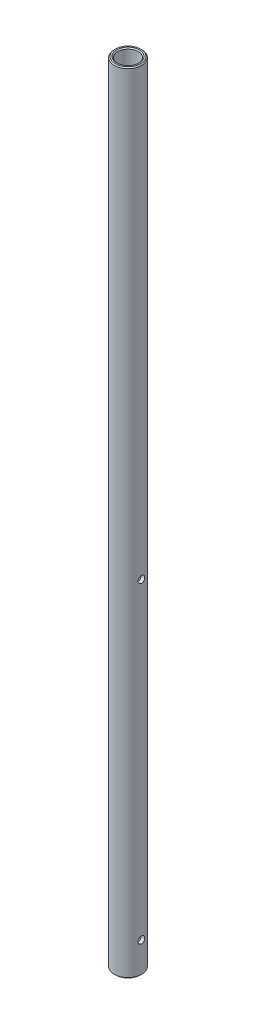
from build123d import *

# Parameters (mm, degrees)
SKETCH_1_R               = 4
SKETCH_1_R_2             = 3
EXTRUDE_1_DEPTH          = 230
CHAMFER_1_SIZE           = 0.3
CUT_EXTRUDE_1_DEPTH      = 231.0695547
CUT_EXTRUDE_1_DEPTH_BACK = 231.0695547
SKETCH_2_R               = 1
CUT_EXTRUDE_2_DEPTH      = 231.069554704
CUT_EXTRUDE_2_DEPTH_BACK = 231.069554704
SKETCH_3_R               = 1


with BuildPart() as part:
    # Эскиз1 → Бобышка-Вытянуть1 (new body)
    with BuildSketch(Plane(origin=(0, 0, 0), x_dir=(1, 0, 0), z_dir=(0, 1, 0))):
        Circle(SKETCH_1_R)
        Circle(SKETCH_1_R_2, mode=Mode.SUBTRACT)
    extrude(amount=EXTRUDE_1_DEPTH)

    # Фаска1
    chamfer_1_edges = [part.edges().sort_by_distance(p)[0] for p in [
        (-3, 230, 0),
        (-3, 0, 0),
        (-4, 0, 0),
        (-4, 230, 0),
    ]]
    chamfer(chamfer_1_edges, length=CHAMFER_1_SIZE)

    # Эскиз2 → Вырез-Вытянуть1 (cut, two sides: drawn at the far end of the back side and taken through both)
    with BuildSketch(Plane(origin=(0, 0, 0), x_dir=(0, 0, -1), z_dir=(1, 0, 0)).offset(-CUT_EXTRUDE_1_DEPTH_BACK)):
        with Locations((0, 9)):
            Circle(SKETCH_2_R)
    extrude(amount=CUT_EXTRUDE_1_DEPTH + CUT_EXTRUDE_1_DEPTH_BACK, mode=Mode.SUBTRACT)

    # Эскиз3 → Вырез-Вытянуть2 (cut, two sides: drawn at the far end of the back side and taken through both)
    with BuildSketch(Plane(origin=(0, 0, 0), x_dir=(0, 0, -1), z_dir=(1, 0, 0)).offset(-CUT_EXTRUDE_2_DEPTH_BACK)):
        with Locations((0, 100)):
            Circle(SKETCH_3_R)
    extrude(amount=CUT_EXTRUDE_2_DEPTH + CUT_EXTRUDE_2_DEPTH_BACK, mode=Mode.SUBTRACT)


solid = part.part
